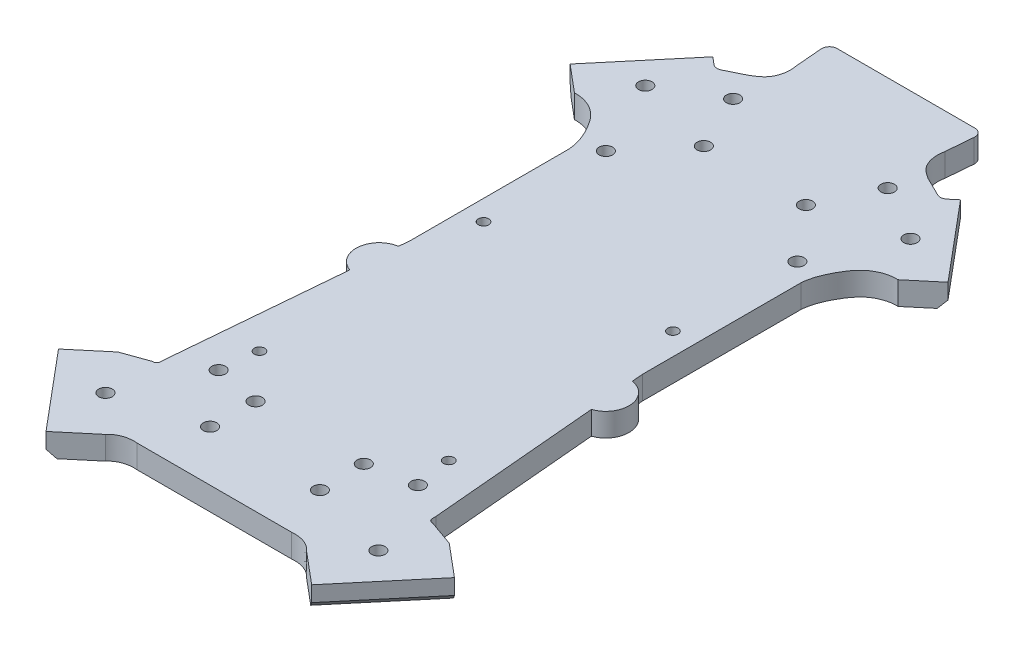
from build123d import *

# Parameters (mm, degrees)
SKETCH1_W               = 200
SKETCH1_H               = 200
BOSS_EXTRUDE1_DEPTH     = 6
CUT_EXTRUDE2_DEPTH      = 283.906344927
CUT_EXTRUDE2_DEPTH_BACK = 283.906344927
SKETCH2_W               = 200
SKETCH2_H               = 200
F_3_0MM_DOWEL_HOLE1_D   = 3.5
CUT_EXTRUDE3_DEPTH      = 2.2
CUT_EXTRUDE4_DEPTH      = 253.068671137
CUT_EXTRUDE4_DEPTH_BACK = 253.068671137
SKETCH7_R               = 1.35
CHAMFER2_SIZE           = 2


with BuildPart() as part:
    # Sketch1 → Boss-Extrude1 (new body)
    with BuildSketch(Plane(origin=(0, 0, 0), x_dir=(1, 0, 0), z_dir=(0, 1, 0))):
        with Locations((100, 100)):
            Rectangle(SKETCH1_W, SKETCH1_H)
    extrude(amount=BOSS_EXTRUDE1_DEPTH)

    # Sketch2 → Cut-Extrude2 (cut, two sides: drawn at the far end of the back side and taken through both)
    with BuildSketch(Plane.XZ.offset(-CUT_EXTRUDE2_DEPTH_BACK)):
        with Locations((100, -100)):
            Rectangle(SKETCH2_W, SKETCH2_H)
        with BuildLine():
            Line((143.206271193, -38.474324409), (139.348594785, -82.567767518))
            ThreePointArc((139.348594785, -82.567767518), (143.379983208, -88.766434624), (138.333453387, -94.170886794))
            Line((138.333453387, -94.170886794), (138.081926157, -97.045856194))
            Line((138.081926157, -97.045856194), (138.081926157, -138.122302946))
            add(Edge.make_bspline(
                [(138.081926157, -138.122302946), (138.278975851, -140.698668058), (139.875728414, -144.457777808), (142.857744695, -148.872811892), (146.317973862, -150.949581622), (148.711949093, -151.375215706), (149.949728435, -151.314063385)],
                knots=[0, 0, 0, 0, 0.390118071, 0.632217601, 0.80816104, 1, 1, 1, 1], degree=3))
            Line((149.949728435, -151.314063385), (152.427141355, -153.392859652))
            Line((152.427141355, -153.392859652), (156.986289622, -157.218439282))
            Line((156.986289622, -157.218439282), (140.128546247, -177.308715512))
            Line((140.128546247, -177.308715512), (138.240322968, -175.724308055))
            ThreePointArc((138.240322968, -175.724308055), (137.193424318, -175.270689638), (136.068850381, -175.463303007))
            Line((136.068850381, -175.463303007), (131.221602423, -177.858138058))
            add(Edge.make_bspline(
                [(131.221602423, -177.858138058), (130.290319693, -178.448630846), (127.409900415, -180.257259881), (126.872641948, -184.051623218), (127.295030079, -186.070348817)],
                knots=[0, 0, 0, 0, 0.342840888, 1, 1, 1, 1], degree=3))
            Line((127.295030079, -186.070348817), (127.889240978, -193.074431936))
            ThreePointArc((127.889240978, -193.074431936), (127.369175496, -194.596619441), (125.896399807, -195.243500167))
            Line((125.896399807, -195.243500167), (90.267452507, -195.243500167))
            ThreePointArc((90.267452507, -195.243500167), (88.794676818, -194.596619441), (88.274611336, -193.074431936))
            Line((88.274611336, -193.074431936), (88.868822234, -186.070348817))
            add(Edge.make_bspline(
                [(84.942249891, -177.858138058), (85.87353262, -178.448630846), (88.753951899, -180.257259881), (89.291210366, -184.051623218), (88.868822234, -186.070348817)],
                knots=[0, 0, 0, 0, 0.342840888, 1, 1, 1, 1], degree=3))
            Line((84.942249891, -177.858138058), (80.095001932, -175.463303007))
            ThreePointArc((80.095001932, -175.463303007), (78.970427995, -175.270689638), (77.923529346, -175.724308055))
            Line((77.923529346, -175.724308055), (76.035306067, -177.308715512))
            Line((76.035306067, -177.308715512), (59.177562691, -157.218439282))
            Line((59.177562691, -157.218439282), (63.736710959, -153.392859652))
            Line((63.736710959, -153.392859652), (66.214123879, -151.314063385))
            add(Edge.make_bspline(
                [(78.081926157, -138.122302946), (77.884876463, -140.698668058), (76.2881239, -144.457777808), (73.306107618, -148.872811892), (69.845878452, -150.949581622), (67.451903221, -151.375215706), (66.214123879, -151.314063385)],
                knots=[0, 0, 0, 0, 0.390118071, 0.632217601, 0.80816104, 1, 1, 1, 1], degree=3))
            Line((78.081926157, -138.122302946), (78.081926157, -97.045856194))
            Line((78.081926157, -97.045856194), (77.830398926, -94.170886794))
            ThreePointArc((77.830398926, -94.170886794), (72.783869106, -88.766434624), (76.815257528, -82.567767518))
            Line((76.815257528, -82.567767518), (72.95758112, -38.474324409))
            add(Edge.make_bspline(
                [(71.87426297, -36.548342356), (73.029938343, -36.460716162), (72.980934293, -37.754807476), (72.95758112, -38.474324409)],
                knots=[0, 0, 0, 0, 1, 1, 1, 1], degree=3))
            Line((71.87426297, -36.548342356), (65.214123879, -34.172936949))
            Line((65.214123879, -34.172936949), (56.844705507, -27.15016108))
            Line((56.844705507, -27.15016108), (73.702448882, -7.059884849))
            Line((73.702448882, -7.059884849), (82.071867254, -14.082660719))
            add(Edge.make_bspline(
                [(82.071867254, -14.082660719), (83.53149801, -15.797125086), (85.909052418, -16.455495951), (88.081926157, -16.243500167)],
                knots=[0, 0, 0, 0, 1, 1, 1, 1], degree=3))
            Line((88.081926157, -16.243500167), (128.081926157, -16.243500167))
            add(Edge.make_bspline(
                [(134.09198506, -14.082660719), (132.632354304, -15.797125086), (130.254799895, -16.455495951), (128.081926157, -16.243500167)],
                knots=[0, 0, 0, 0, 1, 1, 1, 1], degree=3))
            Line((134.09198506, -14.082660719), (142.461403432, -7.059884849))
            Line((142.461403432, -7.059884849), (159.319146807, -27.15016108))
            Line((159.319146807, -27.15016108), (150.949728435, -34.172936949))
            Line((150.949728435, -34.172936949), (144.289589344, -36.548342356))
            add(Edge.make_bspline(
                [(144.289589344, -36.548342356), (143.133913971, -36.460716162), (143.182918021, -37.754807476), (143.206271193, -38.474324409)],
                knots=[0, 0, 0, 0, 1, 1, 1, 1], degree=3))
        make_face(mode=Mode.SUBTRACT)
    extrude(amount=CUT_EXTRUDE2_DEPTH + CUT_EXTRUDE2_DEPTH_BACK, mode=Mode.SUBTRACT)

    # Ø3.0mm Dowel Hole1 (through all)
    with Locations(Plane(origin=(0, 0, 0), x_dir=(-1, 0, 0), z_dir=(0, -1, 0))):
        with Locations((-83.29683767, 142.349100179), (-94.867014644, 156.137900155), (-121.29683767, 156.137900155), (-132.867014644, 142.349100179), (-128.081926157, 170.503802501), (-142.402815019, 162.099252361), (-88.081926157, 170.503802501), (-73.761037294, 162.099252361), (-133.867014644, 43.137900155), (-122.081926157, 40.922048355), (-122.29683767, 29.349100179), (-94.081926157, 40.922048355), (-93.867014644, 29.349100179), (-82.29683767, 43.137900155), (-72.761037294, 23.387747973), (-143.402815019, 23.387747973)):
            Hole(F_3_0MM_DOWEL_HOLE1_D / 2)

    # Sketch6 → Cut-Extrude3 (cut)
    with BuildSketch(Plane.XZ):
        Polygon((125.09683767, -27.732519425), (122.29683767, -26.115938672), (119.49683767, -27.732519425), (119.49683767, -30.965680933), (122.29683767, -32.582261686), (125.09683767, -30.965680933), align=None)
        Polygon((133.867014644, -39.904738648), (131.067014644, -41.521319401), (131.067014644, -44.754480909), (133.867014644, -46.371061663), (136.667014644, -44.754480909), (136.667014644, -41.521319401), align=None)
        Polygon((82.29683767, -39.904738648), (79.49683767, -41.521319401), (79.49683767, -44.754480909), (82.29683767, -46.371061663), (85.09683767, -44.754480909), (85.09683767, -41.521319401), align=None)
        Polygon((93.867014644, -26.115938672), (91.067014644, -27.732519425), (91.067014644, -30.965680933), (93.867014644, -32.582261686), (96.667014644, -30.965680933), (96.667014644, -27.732519425), align=None)
        Polygon((94.867014644, -152.904738648), (92.067014644, -154.521319401), (92.067014644, -157.754480909), (94.867014644, -159.371061663), (97.667014644, -157.754480909), (97.667014644, -154.521319401), align=None)
        Polygon((83.29683767, -139.115938672), (80.49683767, -140.732519425), (80.49683767, -143.965680933), (83.29683767, -145.582261686), (86.09683767, -143.965680933), (86.09683767, -140.732519425), align=None)
        Polygon((121.29683767, -152.904738648), (118.49683767, -154.521319401), (118.49683767, -157.754480909), (121.29683767, -159.371061663), (124.09683767, -157.754480909), (124.09683767, -154.521319401), align=None)
        Polygon((132.867014644, -145.582261686), (135.667014644, -143.965680933), (135.667014644, -140.732519425), (132.867014644, -139.115938672), (130.067014644, -140.732519425), (130.067014644, -143.965680933), align=None)
    extrude(amount=-CUT_EXTRUDE3_DEPTH, mode=Mode.SUBTRACT)

    # Sketch7 → Cut-Extrude4 (cut, two sides: drawn at the far end of the back side and taken through both)
    with BuildSketch(Plane(origin=(0, 0, 0), x_dir=(-1, 0, 0), z_dir=(0, -1, 0)).offset(-CUT_EXTRUDE4_DEPTH_BACK)):
        with Locations((-83.342469641, 52.660274031)):
            Circle(SKETCH7_R)
        with Locations((-132.342469641, 52.660274031)):
            Circle(SKETCH7_R)
        with Locations((-83.342469641, 110.660274031)):
            Circle(SKETCH7_R)
        with Locations((-132.342469641, 110.660274031)):
            Circle(SKETCH7_R)
    extrude(amount=CUT_EXTRUDE4_DEPTH + CUT_EXTRUDE4_DEPTH_BACK, mode=Mode.SUBTRACT)

    # Chamfer2
    chamfer2_edges = [part.edges().sort_by_distance(p)[0] for p in [
        (148.557417935, 0, -167.263577397),
        (67.606434379, 0, -167.263577397),
        (65.273577194, 0, -17.105022965),
        (150.89027512, 0, -17.105022965),
    ]]
    chamfer(chamfer2_edges, length=CHAMFER2_SIZE)


solid = part.part
